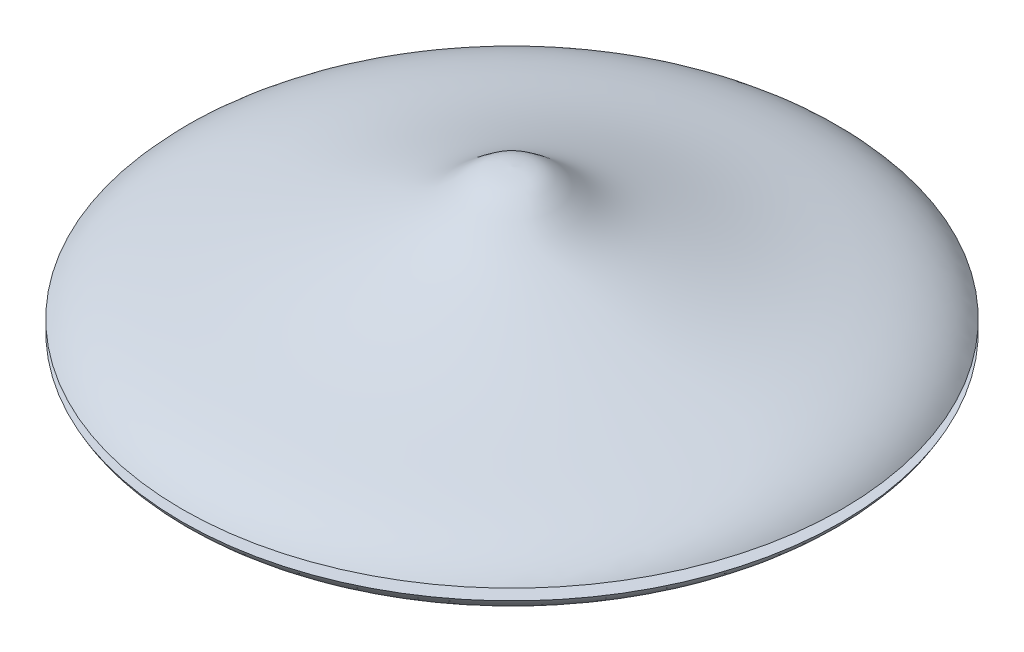
from build123d import *

# Parameters (mm, degrees)
SHELL_13_T                       = -2
SKETCH_2_W                       = 10
SKETCH_2_H                       = 3
CUT_EXTRUDE_1_DEPTH              = 271
FILLET_1_R                       = 1
PATTERN_CIRCULAR_1_COUNT         = 20
FILLET_1_OF_PATTERN_CIRCULAR_1_R = 1


# Read off the part's stored shape, not the designer's step: 旋转1, 分割2
with BuildPart() as part:
    # 旋转1 outline → 旋转1 (revolve)
    with BuildSketch(Plane.XY):
        with BuildLine():
            Line((0, 60), (0, -70))
            add(Edge.make_bspline(
                [(0, -70), (0.779494045, -70.018102386), (1.54349499, -70.034544325), (27.223785899, -70.520838767), (35.812663986, -67.699015528), (45.753641527, -40.847751284), (58.842437547, -24.224144722), (91.788047688, -35.419293731), (143.768688707, -19.533365581), (150, -5)],
                knots=[0.970833987, 0.970833987, 0.970833987, 0.970833987, 0.970833987, 0.970833987, 0.970833987, 0.970833987, 1, 1, 1.970833987, 1.970833987, 1.970833987, 1.970833987, 1.970833987, 1.970833987, 1.970833987, 1.970833987], degree=7))
            Line((150, -5), (140, -5))
            Line((140, -5), (140, 0))
            Line((140, 0), (150, 0))
            add(Edge.make_bspline(
                [(150, 0), (148.947149417, 1.342934164), (147.822698998, 2.580635835), (146.635157273, 3.722835453), (119.131146596, 27.083441425), (67.999536491, 12.066729709), (63.14784772, 40.082237438), (35.985027936, 39.794313027), (30.060066805, 33.276969956), (16.583639754, 58.141927425), (17.538650575, 58.81401521), (0, 60)],
                knots=[0.954811349, 0.954811349, 0.954811349, 0.954811349, 0.954811349, 0.954811349, 0.954811349, 0.954811349, 0.954811349, 1, 1, 1, 1.954811349, 1.954811349, 1.954811349, 1.954811349, 1.954811349, 1.954811349, 1.954811349, 1.954811349, 1.954811349], degree=8))
        make_face()
    revolve(axis=Axis((0, 0, 0), (0, 1, 0)))


with BuildPart() as body_2:
    # Split Bodies 1: the piece on the far side of the plane
    add(part.part)
    split(bisect_by=Plane(origin=(0, 0, 0), x_dir=(-1, 0, 0), z_dir=(0, -1, 0)), keep=Keep.BOTTOM)


with BuildPart() as part_1:
    add(part.part)

    # Split Bodies 1
    split(bisect_by=Plane(origin=(0, 0, 0), x_dir=(-1, 0, 0), z_dir=(0, -1, 0)), keep=Keep.TOP)


with BuildPart() as body_3:
    # Split Bodies 2: the piece on the far side of the plane
    add(part_1.part)
    split(bisect_by=Plane(origin=(0, -5, 0), x_dir=(1, 0, 0), z_dir=(0, 1, 0)), keep=Keep.BOTTOM)


with BuildPart() as part_2:
    add(part_1.part)

    # Split Bodies 2
    split(bisect_by=Plane(origin=(0, -5, 0), x_dir=(1, 0, 0), z_dir=(0, 1, 0)), keep=Keep.TOP)

    # 抽壳13
    shell_13_openings = [part_2.faces().sort_by_distance(p)[0] for p in [
        (0, 0, 0),
        (0, -5, 0),
    ]]
    offset(amount=SHELL_13_T, openings=shell_13_openings, kind=Kind.INTERSECTION)

    # 草图2 → 切除-拉伸1 (cut)
    with BuildSketch(Plane.XY):
        with Locations((0, -2.5)):
            Rectangle(SKETCH_2_W, SKETCH_2_H)
    cut_extrude_1 = extrude(amount=CUT_EXTRUDE_1_DEPTH, mode=Mode.SUBTRACT)

    # 圆角1
    fillet_1_edges = [part_2.edges().sort_by_distance(p)[0] for p in [
        (5, -4, 138.91003817),
        (5, -1, 138.91003817),
        (-5, -1, 138.91003817),
        (-5, -4, 138.91003817),
    ]]
    fillet(fillet_1_edges, radius=FILLET_1_R)

    # 阵列(圆周)1: 切除-拉伸1 ×20 about axis
    pattern_circular_1_axis = Axis((0, 0, 0), (0, 1, 0))
    for i in range(1, PATTERN_CIRCULAR_1_COUNT):
        add(cut_extrude_1.rotate(pattern_circular_1_axis, i * 360 / PATTERN_CIRCULAR_1_COUNT), mode=Mode.SUBTRACT)

    # 圆角1 of 阵列(圆周)1
    fillet_1_of_pattern_circular_1_edges = [part_2.edges().sort_by_distance(p)[0] for p in [
        (47.680845065, -4, 130.566212008),
        (47.680845065, -1, 130.566212008),
        (38.170279902, -1, 133.656381952),
        (38.170279902, -4, 133.656381952),
        (85.694356803, -4, 109.441655307),
        (85.694356803, -1, 109.441655307),
        (77.60418686, -1, 115.31950783),
        (77.60418686, -4, 115.31950783),
        (115.31950783, -4, 77.60418686),
        (115.31950783, -1, 77.60418686),
        (109.441655307, -1, 85.694356803),
        (109.441655307, -4, 85.694356803),
        (133.656381952, -4, 38.170279902),
        (133.656381952, -1, 38.170279902),
        (130.566212008, -1, 47.680845065),
        (130.566212008, -4, 47.680845065),
        (138.91003817, -4, -5),
        (138.91003817, -1, -5),
        (138.91003817, -1, 5),
        (138.91003817, -4, 5),
        (130.566212008, -4, -47.680845065),
        (130.566212008, -1, -47.680845065),
        (133.656381952, -1, -38.170279902),
        (133.656381952, -4, -38.170279902),
        (109.441655307, -4, -85.694356803),
        (109.441655307, -1, -85.694356803),
        (115.31950783, -1, -77.60418686),
        (115.31950783, -4, -77.60418686),
        (77.60418686, -4, -115.31950783),
        (77.60418686, -1, -115.31950783),
        (85.694356803, -1, -109.441655307),
        (85.694356803, -4, -109.441655307),
        (38.170279902, -4, -133.656381952),
        (38.170279902, -1, -133.656381952),
        (47.680845065, -1, -130.566212008),
        (47.680845065, -4, -130.566212008),
        (-5, -4, -138.91003817),
        (-5, -1, -138.91003817),
        (5, -1, -138.91003817),
        (5, -4, -138.91003817),
        (-47.680845065, -4, -130.566212008),
        (-47.680845065, -1, -130.566212008),
        (-38.170279902, -1, -133.656381952),
        (-38.170279902, -4, -133.656381952),
        (-85.694356803, -4, -109.441655307),
        (-85.694356803, -1, -109.441655307),
        (-77.60418686, -1, -115.31950783),
        (-77.60418686, -4, -115.31950783),
        (-115.31950783, -4, -77.60418686),
        (-115.31950783, -1, -77.60418686),
        (-109.441655307, -1, -85.694356803),
        (-109.441655307, -4, -85.694356803),
        (-133.656381952, -4, -38.170279902),
        (-133.656381952, -1, -38.170279902),
        (-130.566212008, -1, -47.680845065),
        (-130.566212008, -4, -47.680845065),
        (-138.91003817, -4, 5),
        (-138.91003817, -1, 5),
        (-138.91003817, -1, -5),
        (-138.91003817, -4, -5),
        (-130.566212008, -4, 47.680845065),
        (-130.566212008, -1, 47.680845065),
        (-133.656381952, -1, 38.170279902),
        (-133.656381952, -4, 38.170279902),
        (-109.441655307, -4, 85.694356803),
        (-109.441655307, -1, 85.694356803),
        (-115.31950783, -1, 77.60418686),
        (-115.31950783, -4, 77.60418686),
        (-77.60418686, -4, 115.31950783),
        (-77.60418686, -1, 115.31950783),
        (-85.694356803, -1, 109.441655307),
        (-85.694356803, -4, 109.441655307),
        (-38.170279902, -4, 133.656381952),
        (-38.170279902, -1, 133.656381952),
        (-47.680845065, -1, 130.566212008),
        (-47.680845065, -4, 130.566212008),
    ]]
    fillet(fillet_1_of_pattern_circular_1_edges, radius=FILLET_1_OF_PATTERN_CIRCULAR_1_R)


solid = Compound([body_2.part, body_3.part, part_2.part])
